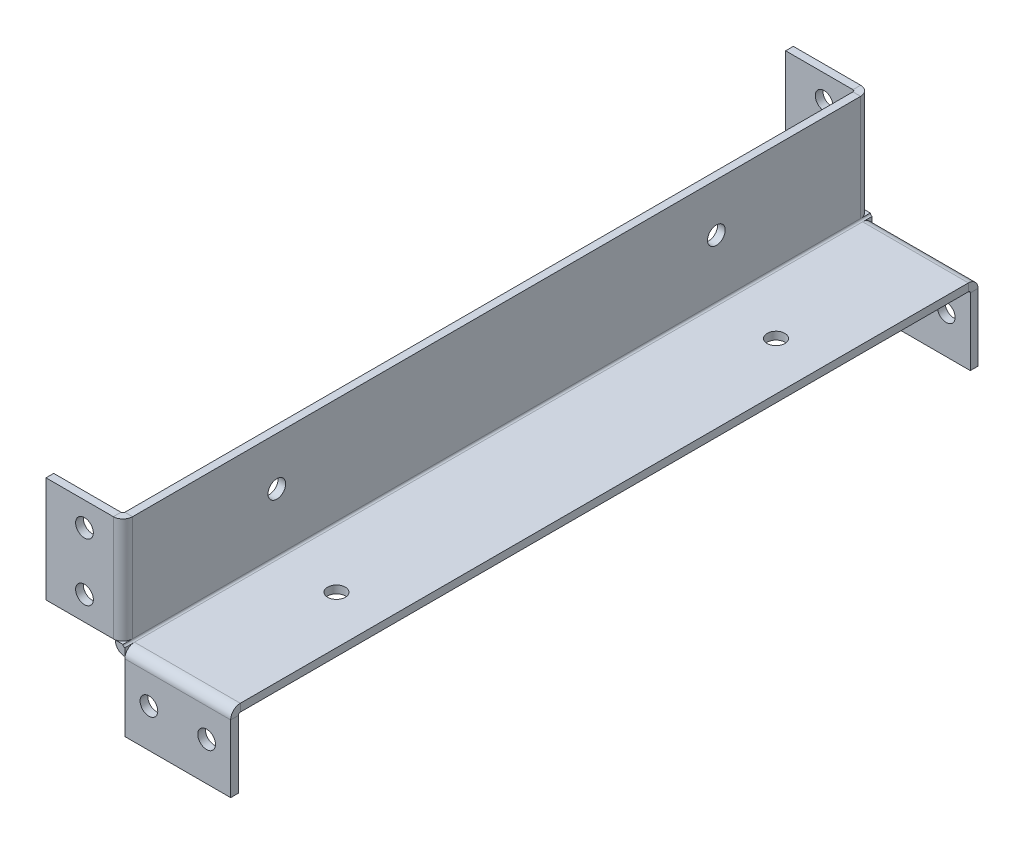
from build123d import *

# Parameters (mm, degrees)
SKETCH1_W                      = 60
SKETCH1_H                      = 388.5
BASE_FLANGE1_DEPTH             = 4
EDGE_FLANGE1_STRIP_W           = 18
EDGE_FLANGE1_STRIP_H           = 4
EDGE_FLANGE1_STRIP_CUT_DEPTH   = 388.5
EDGE_FLANGE1_DEPTH             = 388.5
EDGE_FLANGE2_STRIP_W           = 18
EDGE_FLANGE2_STRIP_H           = 4
EDGE_FLANGE2_STRIP_CUT_DEPTH   = 55
EDGE_FLANGE2_STRIP_2_W         = 18
EDGE_FLANGE2_STRIP_2_H         = 4
EDGE_FLANGE2_STRIP_CUT_2_DEPTH = 55
EDGE_FLANGE2_STRIP_3_W         = 18
EDGE_FLANGE2_STRIP_3_H         = 4
EDGE_FLANGE2_STRIP_CUT_3_DEPTH = 55
EDGE_FLANGE2_STRIP_4_W         = 18
EDGE_FLANGE2_STRIP_4_H         = 4
EDGE_FLANGE2_STRIP_CUT_4_DEPTH = 55
EDGE_FLANGE2_DEPTH             = 55
EDGE_FLANGE2_BEND_DEPTH        = 55
EDGE_FLANGE2_BEND_2_DEPTH      = 55
EDGE_FLANGE2_BEND_3_DEPTH      = 55
SKETCH18_R                     = 4.6
EXTRUDE1_DEPTH                 = 399.607890037
SKETCH19_R                     = 4.6
EXTRUDE2_DEPTH                 = 4
SKETCH20_R                     = 4.6
EXTRUDE3_DEPTH                 = 4


# Sheet-metal steps are written as plain solids
with BuildPart() as part:
    # Sketch1 → Base-Flange1 (new body)
    with BuildSketch(Plane(origin=(0, 0, 0), x_dir=(1, 0, 0), z_dir=(0, 1, 0))):
        Rectangle(SKETCH1_W, SKETCH1_H)
    extrude(amount=BASE_FLANGE1_DEPTH)

    # Edge-Flange1 strip (across the edge) → Edge-Flange1 strip cut (cut)
    with BuildSketch(Plane(origin=(-30, 4, -194.25), x_dir=(1, 0, 0), z_dir=(0, 0, 1))):
        with Locations((-4, -2)):
            Rectangle(EDGE_FLANGE1_STRIP_W, EDGE_FLANGE1_STRIP_H)
    extrude(amount=EDGE_FLANGE1_STRIP_CUT_DEPTH, mode=Mode.SUBTRACT)

    # Edge-Flange1 section (across the edge) → Edge-Flange1 (add)
    with BuildSketch(Plane(origin=(-30, 4, -194.25), x_dir=(1, 0, 0), z_dir=(0, 0, 1))):
        with BuildLine():
            Line((0, 1), (0, 56))
            Line((0, 56), (4, 56))
            Line((4, 56), (4, 1))
            ThreePointArc((4, 1), (4.292893219, 0.292893219), (5, 0))
            Line((5, 0), (5, -4))
            ThreePointArc((5, -4), (1.464466094, -2.535533906), (0, 1))
        make_face()
    extrude(amount=EDGE_FLANGE1_DEPTH)

    # Edge-Flange2 strip (across the edge) → Edge-Flange2 strip cut (cut)
    with BuildSketch(Plane(origin=(-30, 5, 194.25), x_dir=(0, 0, -1), z_dir=(0, 1, 0))):
        with Locations((-4, -2)):
            Rectangle(EDGE_FLANGE2_STRIP_W, EDGE_FLANGE2_STRIP_H)
    extrude(amount=EDGE_FLANGE2_STRIP_CUT_DEPTH, mode=Mode.SUBTRACT)

    # Edge-Flange2 strip 2 (across the edge) → Edge-Flange2 strip cut 2 (cut)
    with BuildSketch(Plane(origin=(30, 0, 194.25), x_dir=(0, 0, -1), z_dir=(-1, 0, 0))):
        with Locations((-4, -2)):
            Rectangle(EDGE_FLANGE2_STRIP_2_W, EDGE_FLANGE2_STRIP_2_H)
    extrude(amount=EDGE_FLANGE2_STRIP_CUT_2_DEPTH, mode=Mode.SUBTRACT)

    # Edge-Flange2 strip 3 (across the edge) → Edge-Flange2 strip cut 3 (cut)
    with BuildSketch(Plane(origin=(-30, 60, -194.25), x_dir=(0, 0, 1), z_dir=(0, -1, 0))):
        with Locations((-4, -2)):
            Rectangle(EDGE_FLANGE2_STRIP_3_W, EDGE_FLANGE2_STRIP_3_H)
    extrude(amount=EDGE_FLANGE2_STRIP_CUT_3_DEPTH, mode=Mode.SUBTRACT)

    # Edge-Flange2 strip 4 (across the edge) → Edge-Flange2 strip cut 4 (cut)
    with BuildSketch(Plane(origin=(-25, 0, -194.25), x_dir=(0, 0, 1), z_dir=(1, 0, 0))):
        with Locations((-4, -2)):
            Rectangle(EDGE_FLANGE2_STRIP_4_W, EDGE_FLANGE2_STRIP_4_H)
    extrude(amount=EDGE_FLANGE2_STRIP_CUT_4_DEPTH, mode=Mode.SUBTRACT)

    # Edge-Flange2 section (across the edge) → Edge-Flange2 (add)
    with BuildSketch(Plane(origin=(-30, 5, 194.25), x_dir=(0, 0, -1), z_dir=(0, 1, 0))):
        with BuildLine():
            Line((0, 1), (0, 36))
            Line((0, 36), (4, 36))
            Line((4, 36), (4, 1))
            ThreePointArc((4, 1), (4.292893219, 0.292893219), (5, 0))
            Line((5, 0), (5, -4))
            ThreePointArc((5, -4), (1.464466094, -2.535533906), (0, 1))
        make_face()
    extrude(amount=EDGE_FLANGE2_DEPTH)

    # Edge-Flange2 section 2 (across the edge) → Edge-Flange2 bend (add)
    with BuildSketch(Plane(origin=(30, 0, 194.25), x_dir=(0, 0, -1), z_dir=(-1, 0, 0))):
        with BuildLine():
            Line((0, 1), (0, 36))
            Line((0, 36), (4, 36))
            Line((4, 36), (4, 1))
            ThreePointArc((4, 1), (4.292893219, 0.292893219), (5, 0))
            Line((5, 0), (5, -4))
            ThreePointArc((5, -4), (1.464466094, -2.535533906), (0, 1))
        make_face()
    extrude(amount=EDGE_FLANGE2_BEND_DEPTH)

    # Edge-Flange2 section 3 (across the edge) → Edge-Flange2 bend 2 (add)
    with BuildSketch(Plane(origin=(-30, 60, -194.25), x_dir=(0, 0, 1), z_dir=(0, -1, 0))):
        with BuildLine():
            Line((0, 1), (0, 36))
            Line((0, 36), (4, 36))
            Line((4, 36), (4, 1))
            ThreePointArc((4, 1), (4.292893219, 0.292893219), (5, 0))
            Line((5, 0), (5, -4))
            ThreePointArc((5, -4), (1.464466094, -2.535533906), (0, 1))
        make_face()
    extrude(amount=EDGE_FLANGE2_BEND_2_DEPTH)

    # Edge-Flange2 section 4 (across the edge) → Edge-Flange2 bend 3 (add)
    with BuildSketch(Plane(origin=(-25, 0, -194.25), x_dir=(0, 0, 1), z_dir=(1, 0, 0))):
        with BuildLine():
            Line((0, 1), (0, 36))
            Line((0, 36), (4, 36))
            Line((4, 36), (4, 1))
            ThreePointArc((4, 1), (4.292893219, 0.292893219), (5, 0))
            Line((5, 0), (5, -4))
            ThreePointArc((5, -4), (1.464466094, -2.535533906), (0, 1))
        make_face()
    extrude(amount=EDGE_FLANGE2_BEND_3_DEPTH)

    # Sketch18 → Extrude1 (cut, through all)
    with BuildSketch(Plane.XY.offset(194.25)):
        with Locations((-46, 47.5)):
            Circle(SKETCH18_R)
        with Locations((-46, 17.5)):
            Circle(SKETCH18_R)
        with Locations((-12.5, -16)):
            Circle(SKETCH18_R)
        with Locations((17.5, -16)):
            Circle(SKETCH18_R)
    extrude(amount=-EXTRUDE1_DEPTH, mode=Mode.SUBTRACT)

    # Sketch19 → Extrude2 (cut)
    with BuildSketch(Plane(origin=(-26, 0, 0), x_dir=(0, 0, -1), z_dir=(1, 0, 0))):
        with Locations(Location((-114.25, 35, 0), (0, 0, 90))):
            Circle(SKETCH19_R)
        with Locations(Location((114.25, 35, 0), (0, 0, 90))):
            Circle(SKETCH19_R)
    extrude(amount=-EXTRUDE2_DEPTH, mode=Mode.SUBTRACT)

    # Sketch20 → Extrude3 (cut)
    with BuildSketch(Plane(origin=(0, 4, 0), x_dir=(1, 0, 0), z_dir=(0, 1, 0))):
        with Locations(Location((5, 114.25, 0), (0, 0, 270))):
            Circle(SKETCH20_R)
        with Locations(Location((5, -114.25, 0), (0, 0, 270))):
            Circle(SKETCH20_R)
    extrude(amount=-EXTRUDE3_DEPTH, mode=Mode.SUBTRACT)


solid = part.part
